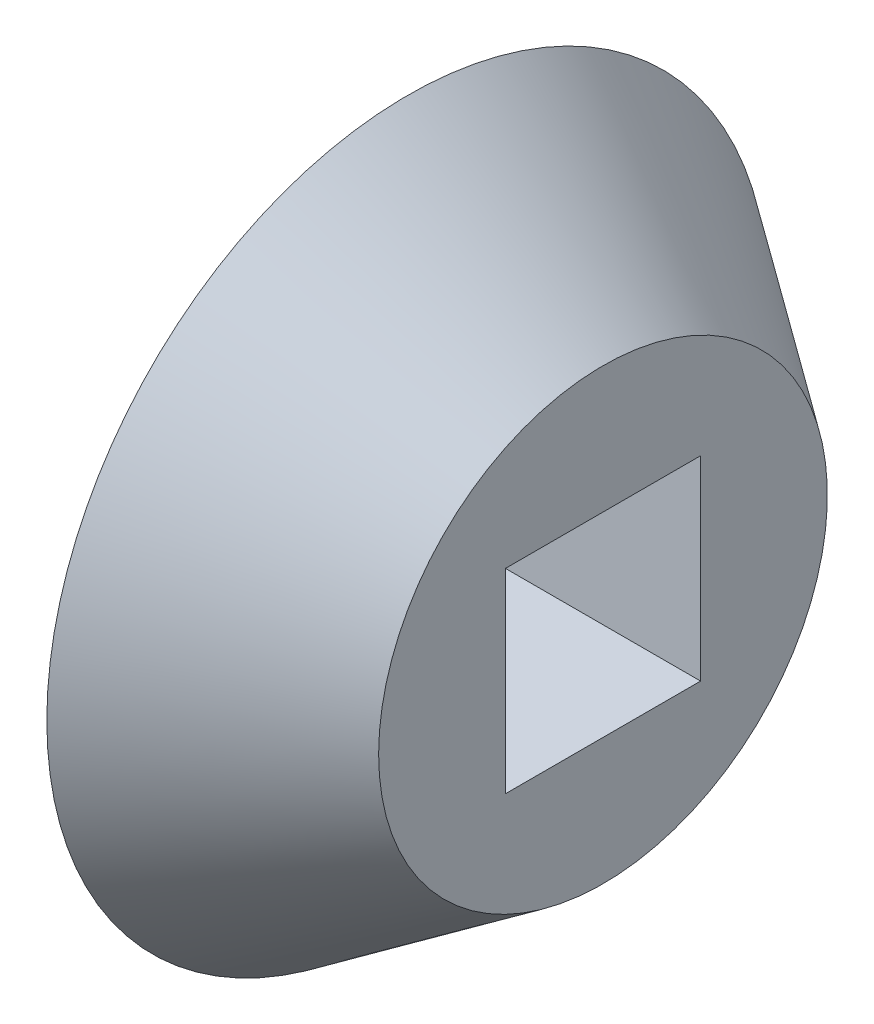
from build123d import *

# Parameters (mm, degrees)
SKETCH1_R           = 5.87375
SKETCH1_W           = 3.175
SKETCH1_H           = 3.175
BOSS_EXTRUDE1_DEPTH = 3.175


with BuildPart() as part:
    # Sketch1 → Boss-Extrude1 (new body)
    with BuildSketch(Plane(origin=(0, 0, 0), x_dir=(0, 0, -1), z_dir=(1, 0, 0))):
        Circle(SKETCH1_R)
        Rectangle(SKETCH1_W, SKETCH1_H, mode=Mode.SUBTRACT)
    extrude(amount=BOSS_EXTRUDE1_DEPTH)

    # Sketch2 → Cut-Revolve1 (revolve, cut)
    with BuildSketch(Plane.XY):
        Polygon((0, 5.87375), (3.175, 5.87375), (3.175, 3.650591066), align=None)
    revolve(axis=Axis((0, 0, 0), (1, 0, 0)), mode=Mode.SUBTRACT)


solid = part.part
